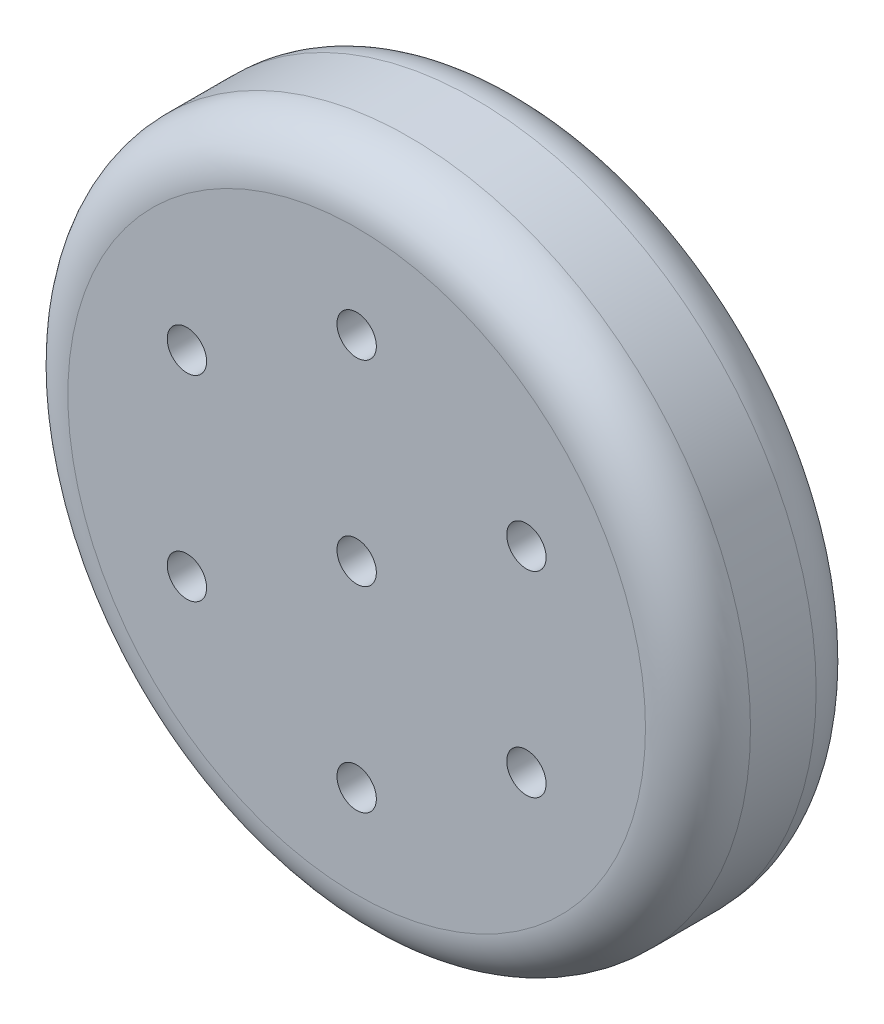
from build123d import *

# Parameters (mm, degrees)
SKETCH_1_R      = 26
EXTRUDE_1_DEPTH = 10
SKETCH_2_R      = 26
SKETCH_2_R_2    = 1.5
EXTRUDE_2_DEPTH = 3
FILLET_1_R      = 4
FILLET_2_R      = 4


with BuildPart() as part:
    # 草图1 → 凸台-拉伸1 (new body)
    with BuildSketch(Plane.XY):
        Circle(SKETCH_1_R)
        with BuildLine():
            ThreePointArc((3, -21), (0, -24), (-3, -21))
            Line((-3, -21), (-3, -17.088665834))
            ThreePointArc((-3, -17.088665834), (-8.675, -15.025540756), (-13.299218729, -11.142409129))
            Line((-13.299218729, -11.142409129), (-16.686533479, -13.098076211))
            ThreePointArc((-16.686533479, -13.098076211), (-20.784609691, -12), (-19.686533479, -7.901923789))
            Line((-19.686533479, -7.901923789), (-16.299218729, -5.946256706))
            ThreePointArc((-16.299218729, -5.946256706), (-17.35, 0), (-16.299218729, 5.946256706))
            Line((-16.299218729, 5.946256706), (-19.686533479, 7.901923789))
            ThreePointArc((-19.686533479, 7.901923789), (-20.784609691, 12), (-16.686533479, 13.098076211))
            Line((-16.686533479, 13.098076211), (-13.299218729, 11.142409129))
            ThreePointArc((-13.299218729, 11.142409129), (-8.675, 15.025540756), (-3, 17.088665834))
            Line((-3, 17.088665834), (-3, 21))
            ThreePointArc((-3, 21), (0, 24), (3, 21))
            Line((3, 21), (3, 17.088665834))
            ThreePointArc((3, 17.088665834), (8.675, 15.025540756), (13.299218729, 11.142409129))
            Line((13.299218729, 11.142409129), (16.686533479, 13.098076211))
            ThreePointArc((16.686533479, 13.098076211), (20.784609691, 12), (19.686533479, 7.901923789))
            Line((19.686533479, 7.901923789), (16.299218729, 5.946256706))
            ThreePointArc((16.299218729, 5.946256706), (17.085285262, 3.019193191), (17.35, 0))
            ThreePointArc((17.35, 0), (17.085285262, -3.019193191), (16.299218729, -5.946256706))
            Line((16.299218729, -5.946256706), (19.686533479, -7.901923789))
            ThreePointArc((19.686533479, -7.901923789), (20.784609691, -12), (16.686533479, -13.098076211))
            Line((16.686533479, -13.098076211), (13.299218729, -11.142409129))
            ThreePointArc((13.299218729, -11.142409129), (8.675, -15.025540756), (3, -17.088665834))
            Line((3, -17.088665834), (3, -21))
        make_face(mode=Mode.SUBTRACT)
    extrude(amount=EXTRUDE_1_DEPTH)

    # 草图2 → 凸台-拉伸2 (add)
    with BuildSketch(Plane.XY.offset(10)):
        Circle(SKETCH_2_R)
        with Locations((0, 14.93)):
            Circle(SKETCH_2_R_2, mode=Mode.SUBTRACT)
        with Locations((12.929759279, 7.465)):
            Circle(SKETCH_2_R_2, mode=Mode.SUBTRACT)
        with Locations((12.929759279, -7.465)):
            Circle(SKETCH_2_R_2, mode=Mode.SUBTRACT)
        with Locations((0, -14.93)):
            Circle(SKETCH_2_R_2, mode=Mode.SUBTRACT)
        with Locations((-12.929759279, -7.465)):
            Circle(SKETCH_2_R_2, mode=Mode.SUBTRACT)
        with Locations((-12.929759279, 7.465)):
            Circle(SKETCH_2_R_2, mode=Mode.SUBTRACT)
        Circle(SKETCH_2_R_2, mode=Mode.SUBTRACT)
    extrude(amount=EXTRUDE_2_DEPTH)

    # 圆角1
    # the kernel refuses this fillet: 4 mm, written as the material it takes off along each edge
    with BuildSketch(Plane(origin=(0, 0, 0), x_dir=(1, 0, 0), z_dir=(0, -1, 0))) as fillet_1_piece_1:
        with BuildLine():
            CenterArc((26 - FILLET_1_R, FILLET_1_R), FILLET_1_R, 270, 90)
            Line((26 - FILLET_1_R, 0), (26, 0))
            Line((26, 0), (26, FILLET_1_R))
        make_face()
    revolve(axis=Axis((0, 0, 0), (0, 0, 1)), mode=Mode.SUBTRACT)
    with BuildSketch(Plane(origin=(0, 0, 13), x_dir=(1, 0, 0), z_dir=(0, -1, 0))) as fillet_1_piece_2:
        with BuildLine():
            CenterArc((26 - FILLET_1_R, -FILLET_1_R), FILLET_1_R, 0, 90)
            Line((26 - FILLET_1_R, 0), (26, 0))
            Line((26, 0), (26, -FILLET_1_R))
        make_face()
    revolve(axis=Axis((0, 0, 13), (0, 0, 1)), mode=Mode.SUBTRACT)

    # 圆角2
    fillet_2_edges = [part.edges().sort_by_distance(p)[0] for p in [
        (-17.35, 0, 0),
        (-8.675, 15.025540756, 0),
        (8.675, 15.025540756, 0),
        (17.35, 0, 0),
        (8.675, -15.025540756, 0),
        (-8.675, -15.025540756, 0),
    ]]
    fillet(fillet_2_edges, radius=FILLET_2_R)


solid = part.part
